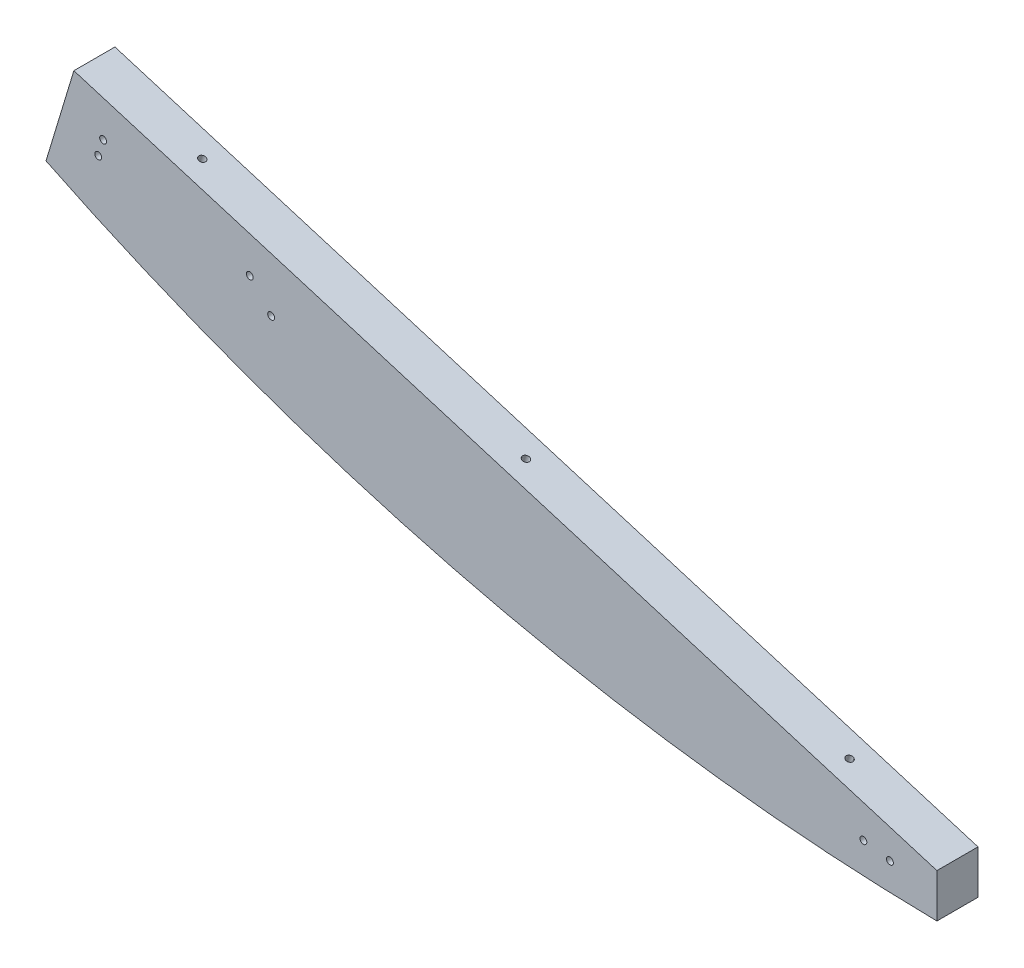
from build123d import *

# Parameters (mm, degrees)
BOSS_EXTRUDE1_DEPTH = 19.05
HOLE1_D             = 3.175
HOLE1_DEPTH         = 31.75
HOLE1_CSINK_D       = 10.16
HOLE1_CSINK_ANGLE   = 82
HOLE1_TIP           = 0.953866233
HOLE2_D             = 3.175
HOLE2_DEPTH         = 31.75
HOLE2_CSINK_D       = 10.16
HOLE2_CSINK_ANGLE   = 82
HOLE2_TIP           = 0.953866233
HOLE3_D             = 3.175
HOLE3_DEPTH         = 31.75
HOLE3_CSINK_D       = 10.16
HOLE3_CSINK_ANGLE   = 82
HOLE3_TIP           = 0.953866233
HOLE4_D             = 3.175
HOLE4_DEPTH         = 38.1
HOLE4_CSINK_D       = 10.16
HOLE4_CSINK_ANGLE   = 82
HOLE4_TIP           = 0.953866233
HOLE5_D             = 3.175
HOLE5_DEPTH         = 38.1
HOLE5_CSINK_D       = 10.16
HOLE5_CSINK_ANGLE   = 82
HOLE5_TIP           = 0.953866233
HOLE6_D             = 3.175
HOLE6_DEPTH         = 38.1
HOLE6_CSINK_D       = 10.16
HOLE6_CSINK_ANGLE   = 82
HOLE6_TIP           = 0.953866233
HOLE7_D             = 3.175
HOLE7_DEPTH         = 38.1
HOLE7_CSINK_D       = 10.16
HOLE7_CSINK_ANGLE   = 82
HOLE7_TIP           = 0.953866233


with BuildPart() as part:
    # Sketch1 → Boss-Extrude1 (new body)
    with BuildSketch(Plane.XY):
        with BuildLine():
            Line((-400.14087824, 384.351673867), (0, 263.246933614))
            Line((0, 263.246933614), (0, 242.994274124))
            ThreePointArc((0, 242.994274124), (-211.987055097, 269.485951335), (-413.059075646, 341.66879585))
            Line((-413.059075646, 341.66879585), (-400.14087824, 384.351673867))
        make_face()
    extrude(amount=-BOSS_EXTRUDE1_DEPTH)

    # Hole1
    with Locations(Plane(origin=(390.375064111, 158.3667868, -217.299999994), x_dir=(0, 0, -1), z_dir=(0.2896786029738461, 0.9571239768071433, 0))):
        with Locations((207.774999994, 613.051808534), (-207.774999994, 613.051808534), (-207.774999994, 456.277103296), (-207.774999994, 769.826513772), (-108.649999997, 456.277103296), (-108.649999997, 630.126513772), (-108.649999997, 769.826513772), (-207.774999994, 356.985551608), (-207.774999994, 294.51834977), (0, 294.51834977), (0, 356.985551608), (207.774999994, 294.51834977), (207.774999994, 356.985551608), (108.649999997, 769.826513772), (108.649999997, 630.126513772), (108.649999997, 456.277103296), (207.774999994, 769.826513772), (207.774999994, 456.277103296)):
            CounterSinkHole(HOLE1_D / 2, HOLE1_CSINK_D / 2, depth=HOLE1_DEPTH, counter_sink_angle=HOLE1_CSINK_ANGLE)
            with Locations((0, 0, -(HOLE1_DEPTH + HOLE1_TIP / 2))):  # 118° drill point
                Cone(0, HOLE1_D / 2, HOLE1_TIP, mode=Mode.SUBTRACT)

    # Hole2
    with Locations(Plane(origin=(277.286738577, -215.287141225, 12.7), x_dir=(-0.08995962873759034, 0.9959454127598536, 0), z_dir=(0, 0, 1))):
        with Locations((637.870011036, 553.595098153), (52.960474705, 241.752641108), (47.697836423, 183.489834462), (434.459074831, 134.806234549), (453.103621196, 177.188747915), (499.723341091, 267.496267453), (636.071223534, 609.111420407), (609.449424187, 543.22015483), (559.371199386, 359.303721429), (507.038658285, 229.776136946)):
            CounterSinkHole(HOLE2_D / 2, HOLE2_CSINK_D / 2, depth=HOLE2_DEPTH, counter_sink_angle=HOLE2_CSINK_ANGLE)
            with Locations((0, 0, -(HOLE2_DEPTH + HOLE2_TIP / 2))):  # 118° drill point
                Cone(0, HOLE2_D / 2, HOLE2_TIP, mode=Mode.SUBTRACT)

    # Hole3
    with Locations(Plane(origin=(277.286738577, -215.287141225, -31.75), x_dir=(0.08995962873759034, -0.9959454127598536, 0), z_dir=(0, 0, -1))):
        with Locations((-507.038658286, 229.776136946), (-559.371199386, 359.303721429), (-637.870011036, 553.595098153), (-628.775118598, 612.059238147), (-597.395815516, 534.392737618), (-496.527007109, 255.428199253), (-441.050012525, 168.361330702), (-426.600990567, 135.51602279), (-41.795304073, 242.761144779), (-36.532665792, 184.498338133)):
            CounterSinkHole(HOLE3_D / 2, HOLE3_CSINK_D / 2, depth=HOLE3_DEPTH, counter_sink_angle=HOLE3_CSINK_ANGLE)
            with Locations((0, 0, -(HOLE3_DEPTH + HOLE3_TIP / 2))):  # 118° drill point
                Cone(0, HOLE3_D / 2, HOLE3_TIP, mode=Mode.SUBTRACT)

    # Hole4
    with Locations(Plane(origin=(-521.705760022, 26.532138606, -217.299999994), x_dir=(0, 0, 1), z_dir=(-0.9571239768071419, 0.2896786029738504, 0))):
        with Locations((-108.649999997, 355.39493603), (108.649999997, 355.39493603), (207.774999994, 355.39493603), (174.999999994, 448.336332751), (135.266666663, 384.042401694), (176.283333328, 384.042401694), (-174.999999994, 448.336332751), (-135.266666663, 384.042401694), (-176.283333328, 384.042401694), (-207.774999994, 355.39493603)):
            CounterSinkHole(HOLE4_D / 2, HOLE4_CSINK_D / 2, depth=HOLE4_DEPTH, counter_sink_angle=HOLE4_CSINK_ANGLE)
            with Locations((0, 0, -(HOLE4_DEPTH + HOLE4_TIP / 2))):  # 118° drill point
                Cone(0, HOLE4_D / 2, HOLE4_TIP, mode=Mode.SUBTRACT)

    # Hole5
    with Locations(Plane(origin=(-521.705760022, 26.532138606, -118.174999997), x_dir=(0, 0, 1), z_dir=(-0.9571239768071419, 0.2896786029738504, 0))):
        with Locations((-108.649999997, 332.89193461), (108.649999997, 332.89193461), (207.774999994, 332.89193461), (174.999999994, 448.336332751), (135.266666663, 384.042401694), (176.283333328, 384.042401694), (-174.999999994, 448.336332751), (-135.266666663, 384.042401694), (-176.283333328, 384.042401694), (-207.774999994, 332.89193461)):
            CounterSinkHole(HOLE5_D / 2, HOLE5_CSINK_D / 2, depth=HOLE5_DEPTH, counter_sink_angle=HOLE5_CSINK_ANGLE)
            with Locations((0, 0, -(HOLE5_DEPTH + HOLE5_TIP / 2))):  # 118° drill point
                Cone(0, HOLE5_D / 2, HOLE5_TIP, mode=Mode.SUBTRACT)

    # Hole6
    with Locations(Plane(origin=(-521.705760022, 26.532138606, 99.124999997), x_dir=(0, 0, 1), z_dir=(-0.9571239768071419, 0.2896786029738504, 0))):
        with Locations((-108.649999997, 332.89193461), (108.649999997, 332.89193461), (207.774999994, 332.89193461), (174.999999994, 448.336332751), (135.266666663, 384.042401694), (176.283333328, 384.042401694), (-174.999999994, 448.336332751), (-135.266666663, 384.042401694), (-176.283333328, 384.042401694), (-207.774999994, 332.89193461)):
            CounterSinkHole(HOLE6_D / 2, HOLE6_CSINK_D / 2, depth=HOLE6_DEPTH, counter_sink_angle=HOLE6_CSINK_ANGLE)
            with Locations((0, 0, -(HOLE6_DEPTH + HOLE6_TIP / 2))):  # 118° drill point
                Cone(0, HOLE6_D / 2, HOLE6_TIP, mode=Mode.SUBTRACT)

    # Hole7
    with Locations(Plane(origin=(-521.705760022, 26.532138606, 198.249999994), x_dir=(0, 0, 1), z_dir=(-0.9571239768071419, 0.2896786029738504, 0))):
        with Locations((-108.649999997, 355.39493603), (108.649999997, 355.39493603), (207.774999994, 355.39493603), (174.999999994, 448.336332751), (135.266666663, 384.042401694), (176.283333328, 384.042401694), (-174.999999994, 448.336332751), (-135.266666663, 384.042401694), (-176.283333328, 384.042401694), (-207.774999994, 355.39493603)):
            CounterSinkHole(HOLE7_D / 2, HOLE7_CSINK_D / 2, depth=HOLE7_DEPTH, counter_sink_angle=HOLE7_CSINK_ANGLE)
            with Locations((0, 0, -(HOLE7_DEPTH + HOLE7_TIP / 2))):  # 118° drill point
                Cone(0, HOLE7_D / 2, HOLE7_TIP, mode=Mode.SUBTRACT)


solid = part.part
